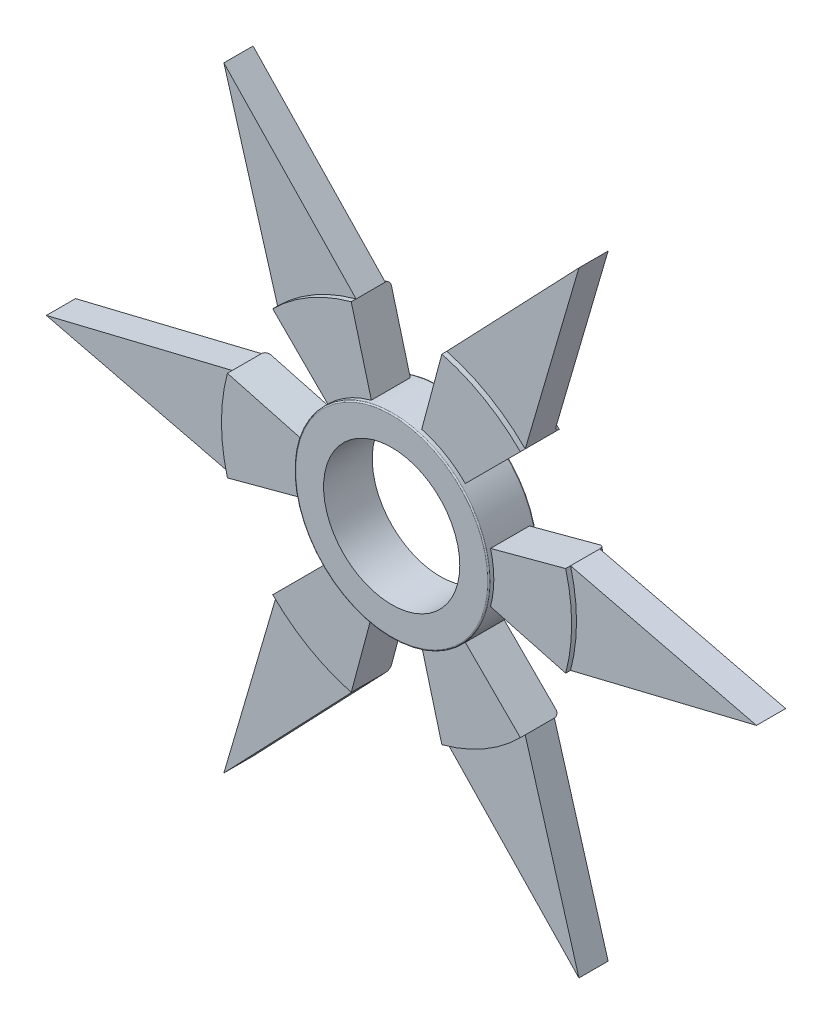
from build123d import *

# Parameters (mm, degrees)
SKETCH1_R           = 20
SKETCH1_R_2         = 14
BOSS_EXTRUDE1_DEPTH = 5
BOSS_EXTRUDE2_DEPTH = 4
BOSS_EXTRUDE3_DEPTH = 3
FILLET1_R           = 0.25
FILLET6_R           = 1


with BuildPart() as part:
    # Sketch1 → Boss-Extrude1 (new, symmetric)
    with BuildSketch(Plane.XY):
        Circle(SKETCH1_R)
        Circle(SKETCH1_R_2, mode=Mode.SUBTRACT)
    extrude(amount=BOSS_EXTRUDE1_DEPTH, both=True)

    # Sketch1<3> → Boss-Extrude2 (add, symmetric)
    with BuildSketch(Plane.XY):
        with BuildLine():
            ThreePointArc((-19.318516526, -5.176380902), (-20, 0), (-19.318516526, 5.176380902))
            Line((-19.318516526, 5.176380902), (-34.773329746, 9.317485624))
            ThreePointArc((-34.773329746, 9.317485624), (-36, 0), (-34.773329746, -9.317485624))
            Line((-34.773329746, -9.317485624), (-19.318516526, -5.176380902))
        make_face()
        with BuildLine():
            ThreePointArc((-14.142135624, 14.142135624), (-10, 17.320508076), (-5.176380902, 19.318516526))
            Line((-5.176380902, 19.318516526), (-9.317485624, 34.773329746))
            ThreePointArc((-9.317485624, 34.773329746), (-18, 31.176914536), (-25.455844123, 25.455844123))
            Line((-25.455844123, 25.455844123), (-14.142135624, 14.142135624))
        make_face()
        with BuildLine():
            ThreePointArc((5.176380902, 19.318516526), (10, 17.320508076), (14.142135624, 14.142135624))
            Line((14.142135624, 14.142135624), (25.455844123, 25.455844123))
            ThreePointArc((25.455844123, 25.455844123), (18, 31.176914536), (9.317485624, 34.773329746))
            Line((9.317485624, 34.773329746), (5.176380902, 19.318516526))
        make_face()
        with BuildLine():
            Line((34.773329746, 9.317485624), (19.318516526, 5.176380902))
            ThreePointArc((19.318516526, 5.176380902), (19.828897227, 2.610523844), (20, 0))
            ThreePointArc((20, 0), (19.828897227, -2.610523844), (19.318516526, -5.176380902))
            Line((19.318516526, -5.176380902), (34.773329746, -9.317485624))
            ThreePointArc((34.773329746, -9.317485624), (36, 0), (34.773329746, 9.317485624))
        make_face()
        with BuildLine():
            Line((25.455844123, -25.455844123), (14.142135624, -14.142135624))
            ThreePointArc((14.142135624, -14.142135624), (10, -17.320508076), (5.176380902, -19.318516526))
            Line((5.176380902, -19.318516526), (9.317485624, -34.773329746))
            ThreePointArc((9.317485624, -34.773329746), (18, -31.176914536), (25.455844123, -25.455844123))
        make_face()
        with BuildLine():
            Line((-9.317485624, -34.773329746), (-5.176380902, -19.318516526))
            ThreePointArc((-5.176380902, -19.318516526), (-10, -17.320508076), (-14.142135624, -14.142135624))
            Line((-14.142135624, -14.142135624), (-25.455844123, -25.455844123))
            ThreePointArc((-25.455844123, -25.455844123), (-18, -31.176914536), (-9.317485624, -34.773329746))
        make_face()
    extrude(amount=BOSS_EXTRUDE2_DEPTH, both=True)

    # Sketch1<4> → Boss-Extrude3 (add, symmetric)
    with BuildSketch(Plane.XY):
        with BuildLine():
            ThreePointArc((-9.317485624, 34.773329746), (-18, 31.176914536), (-25.455844123, 25.455844123))
            Line((-25.455844123, 25.455844123), (-36.5, 63.219854476))
            Line((-36.5, 63.219854476), (-9.317485624, 34.773329746))
        make_face()
        with BuildLine():
            ThreePointArc((25.455844123, 25.455844123), (18, 31.176914536), (9.317485624, 34.773329746))
            Line((9.317485624, 34.773329746), (36.5, 63.219854476))
            Line((36.5, 63.219854476), (25.455844123, 25.455844123))
        make_face()
        with BuildLine():
            ThreePointArc((34.773329746, -9.317485624), (36, 0), (34.773329746, 9.317485624))
            Line((34.773329746, 9.317485624), (73, 0))
            Line((73, 0), (34.773329746, -9.317485624))
        make_face()
        with BuildLine():
            ThreePointArc((9.317485624, -34.773329746), (18, -31.176914536), (25.455844123, -25.455844123))
            Line((25.455844123, -25.455844123), (36.5, -63.219854476))
            Line((36.5, -63.219854476), (9.317485624, -34.773329746))
        make_face()
        with BuildLine():
            ThreePointArc((-25.455844123, -25.455844123), (-18, -31.176914536), (-9.317485624, -34.773329746))
            Line((-9.317485624, -34.773329746), (-36.5, -63.219854476))
            Line((-36.5, -63.219854476), (-25.455844123, -25.455844123))
        make_face()
        with BuildLine():
            ThreePointArc((-34.773329746, 9.317485624), (-36, 0), (-34.773329746, -9.317485624))
            Line((-34.773329746, -9.317485624), (-73, 0))
            Line((-73, 0), (-34.773329746, 9.317485624))
        make_face()
    extrude(amount=BOSS_EXTRUDE3_DEPTH, both=True)

    # Fillet1
    fillet1_edges = [part.edges().sort_by_distance(p)[0] for p in [
        (-20, 0, 5),
        (-20, 0, -5),
    ]]
    fillet(fillet1_edges, radius=FILLET1_R)

    # Fillet6
    # the kernel refuses this fillet: 1 mm, written as the material it adds along each edge
    with BuildSketch(Plane(origin=(0, 0, -3), x_dir=(0.7071067811865468, 0.7071067811865483, 0), z_dir=(0.7071067811865483, -0.7071067811865468, 0))) as fillet6_piece_1_section:
        with BuildLine():
            CenterArc((36 + FILLET6_R, -FILLET6_R), FILLET6_R, 90, 90)
            Line((36 + FILLET6_R, 0), (36, 0))
            Line((36, 0), (36, -FILLET6_R))
        make_face()
    fillet6_piece_1 = revolve(axis=Axis((0, 0, -3), (0, 0, 1)), revolution_arc=30, mode=Mode.PRIVATE)
    fillet6_piece_1 = split(fillet6_piece_1, bisect_by=Plane(origin=(11.853809218, 37.427594574, -3.280987198), z_dir=(0.722987141265996, -0.6908614865253547, 0)), keep=Keep.TOP, mode=Mode.PRIVATE)
    fillet6_piece_1 = split(fillet6_piece_1, bisect_by=Plane(origin=(26.486343095, 28.979497201, -3.280987198), z_dir=(-0.9597971684602362, 0.28069448768316235, 0)), keep=Keep.TOP, mode=Mode.PRIVATE)
    add(fillet6_piece_1)
    # the kernel refuses this fillet: 1 mm, written as the material it takes off along each edge
    with BuildSketch(Plane(origin=(0, 0, -4), x_dir=(0.9456375488425219, -0.325222425762903, 0), z_dir=(-0.325222425762903, -0.9456375488425219, 0))) as fillet6_2_piece_1:
        with BuildLine():
            CenterArc((36 - FILLET6_R, FILLET6_R), FILLET6_R, 270, 90)
            Line((36 - FILLET6_R, 0), (36, 0))
            Line((36, 0), (36, FILLET6_R))
        make_face()
    revolve(axis=Axis((0, 0, -4), (0, 0, 1)), revolution_arc=37.958102254, mode=Mode.SUBTRACT)
    with BuildSketch(Plane(origin=(0, 0, -4), x_dir=(0.19116789183018731, -0.9815573529515235, 0), z_dir=(-0.9815573529515235, -0.19116789183018731, 0))) as fillet6_2_piece_2:
        with BuildLine():
            CenterArc((36 - FILLET6_R, FILLET6_R), FILLET6_R, 270, 90)
            Line((36, FILLET6_R), (36, 0))
            Line((36, 0), (36 - FILLET6_R, 0))
        make_face()
    revolve(axis=Axis((0, 0, -4), (0, 0, 1)), revolution_arc=37.958102254, mode=Mode.SUBTRACT)
    with BuildSketch(Plane(origin=(0, 0, -4), x_dir=(-0.7544696570123329, -0.6563349271886211, 0), z_dir=(-0.6563349271886211, 0.7544696570123329, 0))) as fillet6_2_piece_3:
        with BuildLine():
            CenterArc((36 - FILLET6_R, FILLET6_R), FILLET6_R, 270, 90)
            Line((36, FILLET6_R), (36, 0))
            Line((36, 0), (36 - FILLET6_R, 0))
        make_face()
    revolve(axis=Axis((0, 0, -4), (0, 0, 1)), revolution_arc=37.958102254, mode=Mode.SUBTRACT)
    with BuildSketch(Plane(origin=(0, 0, -4), x_dir=(-0.9456375488425217, 0.32522242576290356, 0), z_dir=(0.32522242576290356, 0.9456375488425217, 0))) as fillet6_2_piece_4:
        with BuildLine():
            CenterArc((36 - FILLET6_R, FILLET6_R), FILLET6_R, 270, 90)
            Line((36 - FILLET6_R, 0), (36, 0))
            Line((36, 0), (36, FILLET6_R))
        make_face()
    revolve(axis=Axis((0, 0, -4), (0, 0, 1)), revolution_arc=37.958102254, mode=Mode.SUBTRACT)
    with BuildSketch(Plane(origin=(0, 0, -4), x_dir=(-0.19116789183018898, 0.9815573529515234, 0), z_dir=(0.9815573529515234, 0.19116789183018898, 0))) as fillet6_2_piece_5:
        with BuildLine():
            CenterArc((36 - FILLET6_R, FILLET6_R), FILLET6_R, 270, 90)
            Line((36 - FILLET6_R, 0), (36, 0))
            Line((36, 0), (36, FILLET6_R))
        make_face()
    revolve(axis=Axis((0, 0, -4), (0, 0, 1)), revolution_arc=37.958102254, mode=Mode.SUBTRACT)


solid = part.part
